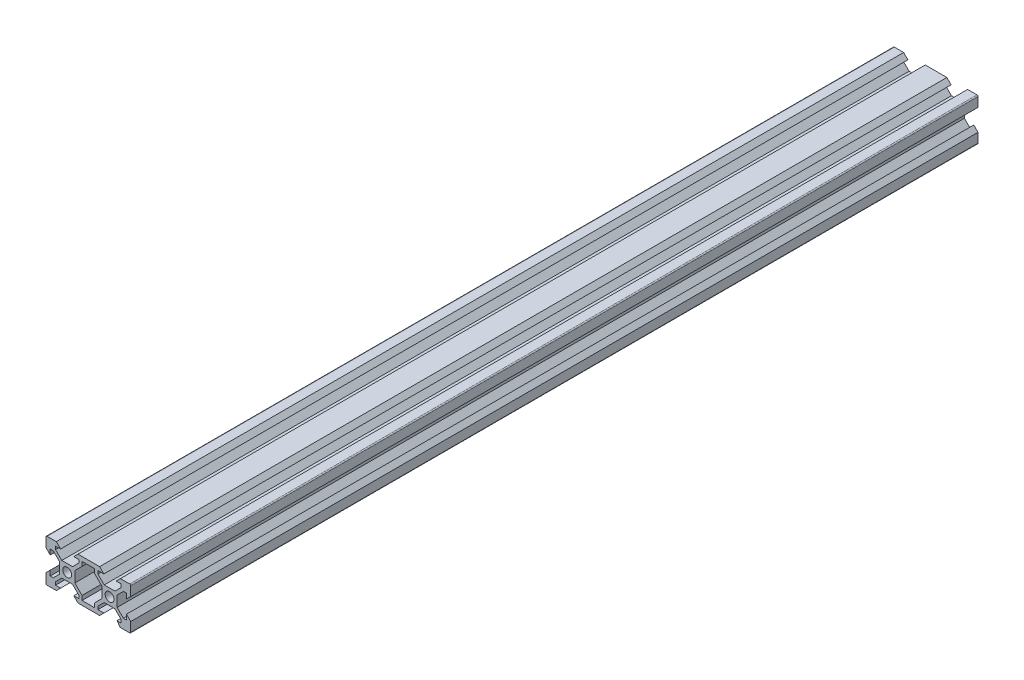
from build123d import *

# Parameters (mm, degrees)
SKETCH1_R           = 2.1
BOSS_EXTRUDE1_DEPTH = 400
FILLET1_R           = 0.5


with BuildPart() as part:
    # Sketch1 → Boss-Extrude1 (new body)
    with BuildSketch(Plane.XY):
        Polygon((-20, -10), (-15.5, -10), (-15.1, -10), (-13.1, -8), (-15.5, -8), (-15.5, -6.560660172), (-12.539339828, -3.6), (-7.460660172, -3.6), (-4.5, -6.560660172), (-4.5, -8), (-6.9, -8), (-4.9, -10), (5.313777138, -10), (7.313777138, -8), (4.5, -8), (4.5, -6.560660172), (7.460660172, -3.6), (12.539339828, -3.6), (15.5, -6.560660172), (15.5, -8), (13.513777138, -8), (15.1, -10), (15.5, -10), (20, -10), (20, -5.5), (20, -5.1), (18, -3.1), (18, -5.5), (16.560660172, -5.5), (13.6, -2.539339828), (13.6, 2.539339828), (16.560660172, 5.5), (18, 5.5), (18, 3.1), (20, 5.1), (20, 5.5), (20, 10), (15.5, 10), (15.1, 10), (13.1, 8), (15.5, 8), (15.5, 6.560660172), (12.539339828, 3.6), (7.460660172, 3.6), (4.5, 6.560660172), (4.5, 8), (7.313777138, 8), (5.313777138, 10), (-4.9, 10), (-6.9, 8), (-4.5, 8), (-4.5, 6.560660172), (-7.460660172, 3.6), (-12.539339828, 3.6), (-15.5, 6.560660172), (-15.5, 8), (-13.1, 8), (-15.1, 10), (-15.5, 10), (-20, 10), (-20, 5.5), (-20, 5.1), (-18, 3.1), (-18, 5.5), (-16.560660172, 5.5), (-13.6, 2.539339828), (-13.6, -2.539339828), (-16.560660172, -5.5), (-18, -5.5), (-18, -3.1), (-20, -5.1), (-20, -5.5), align=None)
        with Locations((-10, 0)):
            Circle(SKETCH1_R, mode=Mode.SUBTRACT)
        with Locations((10, 0)):
            Circle(SKETCH1_R, mode=Mode.SUBTRACT)
        Polygon((3, -5.939339828), (3, -8), (-3, -8), (-3, -5.939339828), (-6.4, -2.539339828), (-6.4, 2.539339828), (-3, 5.939339828), (-3, 8), (3, 8), (3, 5.939339828), (6.4, 2.539339828), (6.4, -2.539339828), align=None, mode=Mode.SUBTRACT)
    extrude(amount=BOSS_EXTRUDE1_DEPTH)

    # Fillet1
    fillet1_edges = [part.edges().sort_by_distance(p)[0] for p in [
        (-20, -10, 200),
        (-20, 10, 200),
        (20, -10, 200),
        (20, 10, 200),
    ]]
    fillet(fillet1_edges, radius=FILLET1_R)


solid = part.part
